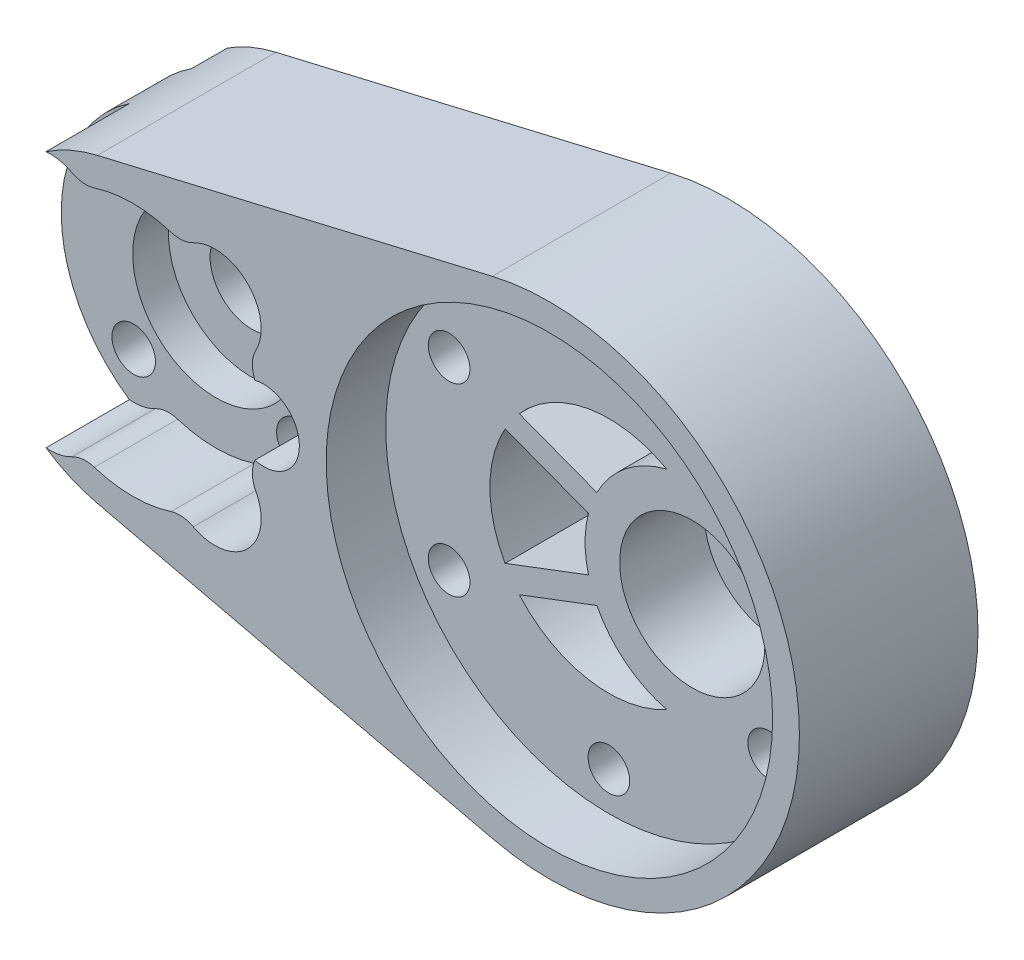
from build123d import *

# Parameters (mm, degrees)
BOSS_EXTRUDE1_DEPTH          = 15
SKETCH6_R                    = 3.5
SKETCH6_R_2                  = 1.8288
HUB_MOUNT_HOLE_PATTERN_DEPTH = 62.660360038
SKETCH7_R                    = 1.75
SKETCH7_R_2                  = 3.25
MOTOR_HOLE_PATTERN_DEPTH     = 62.660360038
SKETCH8_R                    = 18.75
MOTOR_CUTOUT_DEPTH           = 5
HUB_START                    = -7
HUB_MOUNT_CUTOUT_DEPTH       = 7
SKETCH10_R                   = 5
BOSS_EXTRUDE2_DEPTH          = 5.5
LINKAGE_PIN_HOLE_DEPTH       = 62.660360038
LINKAGE_PIN_HOLE_DEPTH_BACK  = 62.660360038
SKETCH12_R                   = 1.55
CHAMFER1_SIZE                = 2.75
SKETCH13_R                   = 6.1
CUT_EXTRUDE7_DEPTH           = 7.1
SKETCH14_R                   = 7
CUT_EXTRUDE8_DEPTH           = 3
SKETCH15_R                   = 3.5
CUT_EXTRUDE9_DEPTH           = 5
CUT_EXTRUDE10_DEPTH          = 62.312722986
CUT_EXTRUDE10_DEPTH_BACK     = 3
SKETCH16_R                   = 3
CUT_EXTRUDE12_DEPTH          = 7
BOSS_EXTRUDE3_REACH          = 63.784
CUT_EXTRUDE13_DEPTH          = 62.660360038
CUT_EXTRUDE13_DEPTH_BACK     = 3
SKETCH19_R                   = 4
FILLET1_R                    = 5


with BuildPart() as part:
    # Sketch2 → Boss-Extrude1 (new body)
    with BuildSketch(Plane.XY):
        with BuildLine():
            Line((-2.971428571, 12.655852885), (30.2, 20.444070045))
            ThreePointArc((30.2, 20.444070045), (56, 0), (30.2, -20.444070045))
            Line((30.2, -20.444070045), (-2.971428571, -12.655852885))
            ThreePointArc((-2.971428571, -12.655852885), (-13, 0), (-2.971428571, 12.655852885))
        make_face()
    extrude(amount=BOSS_EXTRUDE1_DEPTH)

    # Sketch6 → hub mount hole pattern (cut, through all)
    with BuildSketch(Plane.XY.offset(15)):
        Circle(SKETCH6_R)
        with Locations((-6.914797213, 6.914797213)):
            Circle(SKETCH6_R_2)
        with Locations((6.914797213, 6.914797213)):
            Circle(SKETCH6_R_2)
        with Locations((6.914797213, -6.914797213)):
            Circle(SKETCH6_R_2)
        with Locations((-6.914797213, -6.914797213)):
            Circle(SKETCH6_R_2)
    extrude(amount=-HUB_MOUNT_HOLE_PATTERN_DEPTH, mode=Mode.SUBTRACT)

    # Sketch7 → motor hole pattern (cut, through all)
    with BuildSketch(Plane.XY.offset(15)):
        with Locations((21.576606241, 7.75)):
            Circle(SKETCH7_R)
        with Locations((35, 15.5)):
            Circle(SKETCH7_R)
        with Locations((48.423393759, 7.75)):
            Circle(SKETCH7_R)
        with Locations((48.423393759, -7.75)):
            Circle(SKETCH7_R)
        with Locations((35, -15.5)):
            Circle(SKETCH7_R)
        with Locations((21.576606241, -7.75)):
            Circle(SKETCH7_R)
        with Locations((42, 0)):
            Circle(SKETCH7_R_2)
    extrude(amount=-MOTOR_HOLE_PATTERN_DEPTH, mode=Mode.SUBTRACT)

    # Sketch8 → motor cutout (cut)
    with BuildSketch(Plane.XY.offset(15)):
        with Locations((35, 0)):
            Circle(SKETCH8_R)
    extrude(amount=-MOTOR_CUTOUT_DEPTH, mode=Mode.SUBTRACT)

    # Sketch9 → hub mount cutout (cut)
    with BuildSketch(Plane.XY.offset(15).offset(HUB_START)):
        with BuildLine():
            ThreePointArc((-7.281143007, 10.769631215), (-13, 0), (-7.281143007, -10.769631215))
            ThreePointArc((-7.281143007, -10.769631215), (-6.15529138, -10.711783559), (-5.093815501, -10.332103173))
            ThreePointArc((-5.093815501, -10.332103173), (-4.17580433, -10.057753531), (-3.223255475, -10.161014917))
            ThreePointArc((-3.223255475, -10.161014917), (0, -10.66), (3.223255475, -10.161014917))
            ThreePointArc((3.223255475, -10.161014917), (4.17580433, -10.057753531), (5.093815501, -10.332103173))
            ThreePointArc((5.093815501, -10.332103173), (9.652858062, -9.652858062), (10.332103173, -5.093815501))
            ThreePointArc((10.332103173, -5.093815501), (10.057753531, -4.17580433), (10.161014917, -3.223255475))
            ThreePointArc((10.161014917, -3.223255475), (10.66, 0), (10.161014917, 3.223255475))
            ThreePointArc((10.161014917, 3.223255475), (10.057753531, 4.17580433), (10.332103173, 5.093815501))
            ThreePointArc((10.332103173, 5.093815501), (9.652858062, 9.652858062), (5.093815501, 10.332103173))
            ThreePointArc((5.093815501, 10.332103173), (4.17580433, 10.057753531), (3.223255475, 10.161014917))
            ThreePointArc((3.223255475, 10.161014917), (0, 10.66), (-3.223255475, 10.161014917))
            ThreePointArc((-3.223255475, 10.161014917), (-4.17580433, 10.057753531), (-5.093815501, 10.332103173))
            ThreePointArc((-5.093815501, 10.332103173), (-6.15529138, 10.711783559), (-7.281143007, 10.769631215))
        make_face()
    extrude(amount=HUB_MOUNT_CUTOUT_DEPTH, mode=Mode.SUBTRACT)

    # Sketch10 → Boss-Extrude2 (add)
    with BuildSketch(Plane(origin=(0, 0, 0), x_dir=(-1, 0, 0), z_dir=(0, 0, -1))):
        with Locations(Location((-11, 0, 0), (0, 0, 180))):
            Circle(SKETCH10_R)
    extrude(amount=BOSS_EXTRUDE2_DEPTH)

    # Sketch12 → Linkage pin hole (cut, two sides: drawn at the far end of the back side and taken through both)
    with BuildSketch(Plane.XY.offset(-LINKAGE_PIN_HOLE_DEPTH_BACK)):
        with Locations((11, 0)):
            Circle(SKETCH12_R)
    extrude(amount=LINKAGE_PIN_HOLE_DEPTH + LINKAGE_PIN_HOLE_DEPTH_BACK, mode=Mode.SUBTRACT)

    # Chamfer1
    chamfer1_edges = [part.edges().sort_by_distance(p)[0] for p in [
        (6, 0, -5.5),
    ]]
    chamfer(chamfer1_edges, length=CHAMFER1_SIZE)

    # Sketch13 → Cut-Extrude7 (cut)
    with BuildSketch(Plane.XY.offset(10)):
        with Locations((42, 0)):
            Circle(SKETCH13_R)
    extrude(amount=-CUT_EXTRUDE7_DEPTH, mode=Mode.SUBTRACT)

    # Sketch14 → Cut-Extrude8 (cut)
    with BuildSketch(Plane.XY.offset(8)):
        Circle(SKETCH14_R)
    extrude(amount=-CUT_EXTRUDE8_DEPTH, mode=Mode.SUBTRACT)

    # Sketch15 → Cut-Extrude9 (cut)
    with BuildSketch(Plane(origin=(0, 0, 0), x_dir=(-1, 0, 0), z_dir=(0, 0, -1))):
        with Locations((-21.576606241, -7.75)):
            Circle(SKETCH15_R)
        with Locations((-35, -15.5)):
            Circle(SKETCH15_R)
        with Locations((-48.423393759, -7.75)):
            Circle(SKETCH15_R)
        with Locations((-48.423393759, 7.75)):
            Circle(SKETCH15_R)
        with Locations((-35, 15.5)):
            Circle(SKETCH15_R)
        with Locations((-21.576606241, 7.75)):
            Circle(SKETCH15_R)
    extrude(amount=-CUT_EXTRUDE9_DEPTH, mode=Mode.SUBTRACT)

    # Sketch16 → Cut-Extrude10 (cut, two sides: drawn at the far end of the back side and taken through both)
    with BuildSketch(Plane.XY.offset(8).offset(-CUT_EXTRUDE10_DEPTH_BACK)):
        with Locations(Location((11, 0, 0), (0, 0, 104.35596801))):
            Circle(SKETCH16_R)
    extrude(amount=CUT_EXTRUDE10_DEPTH + CUT_EXTRUDE10_DEPTH_BACK, mode=Mode.SUBTRACT)

    # Sketch17 → Cut-Extrude12 (cut)
    with BuildSketch(Plane.XY.offset(10)):
        with BuildLine():
            ThreePointArc((39.857142857, 8.741176309), (25, 0), (39.857142857, -8.741176309))
            ThreePointArc((39.857142857, -8.741176309), (33, 0), (39.857142857, 8.741176309))
        make_face()
    extrude(amount=-CUT_EXTRUDE12_DEPTH, mode=Mode.SUBTRACT)

    # Sketch18 → Boss-Extrude3 (add, up to next)
    with BuildSketch(Plane.XY.offset(10), mode=Mode.PRIVATE) as boss_extrude3_sk1:
        with BuildLine():
            Line((27.471985333, -6.582476371), (33.992343948, -4.108216712))
            ThreePointArc((33.992343948, -4.108216712), (33.585458911, -3.193039032), (33.282779719, -2.238318693))
            Line((33.282779719, -2.238318693), (26.280269544, -4.895538864))
            ThreePointArc((26.280269544, -4.895538864), (26.83245784, -5.769857456), (27.471985333, -6.582476371))
        make_face()
    boss_extrude3_tool1 = extrude(boss_extrude3_sk1.sketch, amount=-BOSS_EXTRUDE3_REACH, mode=Mode.PRIVATE) - part.part
    # Sketch18 → Boss-Extrude3 (add, up to next)
    with BuildSketch(Plane.XY.offset(10), mode=Mode.PRIVATE) as boss_extrude3_sk2:
        with BuildLine():
            Line((27.471985333, 6.582476371), (33.992343948, 4.108216712))
            ThreePointArc((33.992343948, 4.108216712), (33.585458911, 3.193039032), (33.282779719, 2.238318693))
            Line((33.282779719, 2.238318693), (26.280269544, 4.895538864))
            ThreePointArc((26.280269544, 4.895538864), (26.83245784, 5.769857456), (27.471985333, 6.582476371))
        make_face()
    boss_extrude3_tool2 = extrude(boss_extrude3_sk2.sketch, amount=-BOSS_EXTRUDE3_REACH, mode=Mode.PRIVATE) - part.part
    add(boss_extrude3_tool1.solids().sort_by_distance((30.216616, -4.45872, 10))[0])
    add(boss_extrude3_tool2.solids().sort_by_distance((30.216616, 4.45872, 10))[0])

    # Sketch19 → Cut-Extrude13 (cut, two sides: drawn at the far end of the back side and taken through both)
    with BuildSketch(Plane(origin=(0, 0, 0), x_dir=(-1, 0, 0), z_dir=(0, 0, -1)).offset(-CUT_EXTRUDE13_DEPTH_BACK)):
        with Locations(Location((-6.914797213, -6.914797213, 0), (0, 0, 90.325769881))):
            Circle(SKETCH19_R)
        with Locations(Location((-6.914797213, 6.914797213, 0), (0, 0, 269.674230119))):
            Circle(SKETCH19_R)
        with Locations((6.914797213, 6.914797213)):
            Circle(SKETCH19_R)
        with Locations((6.914797213, -6.914797213)):
            Circle(SKETCH19_R)
    extrude(amount=CUT_EXTRUDE13_DEPTH + CUT_EXTRUDE13_DEPTH_BACK, mode=Mode.SUBTRACT)

    # Fillet1
    # the kernel refuses this fillet: 5 mm, written as the material it adds along each edge
    with BuildSketch(Plane(origin=(11, 0, 0), x_dir=(-0.9999950652018581, 0.003141587485879405, 0), z_dir=(-0.003141587485879405, -0.9999950652018581, 0))) as fillet1_piece_1_section:
        with BuildLine():
            CenterArc((9.465142775, 5), FILLET1_R, 206.74368395, 63.25631605)
            Line((9.465142775, 0), (9.465142775, -0.1))
            Line((9.465142775, -0.1), (5, -0.1))
            Line((5, -0.1), (4.9, 0))
            ThreePointArc((4.9, 0), (4.9, 1.375), (4.910697145, 2.705))
            Line((4.910697145, 2.705), (5, 2.75))
        make_face()
    fillet1_piece_1 = revolve(axis=Axis((11, 0, 0), (0, 0, -1)), revolution_arc=359.64, mode=Mode.PRIVATE)
    fillet1_piece_1 = fillet1_piece_1 - Plane(origin=(6.914797213, -6.914797213, -0.76540866), x_dir=(0.0056857263926290095, 0.9999838361270588, 0), z_dir=(0, 0, 1)) * Cylinder(4, 38, mode=Mode.PRIVATE)
    fillet1_piece_1 = fillet1_piece_1 - Plane(origin=(6.914797213, 6.914797213, -0.76540866), x_dir=(0.00568572639262881, -0.9999838361270588, 0), z_dir=(0, 0, 1)) * Cylinder(4, 38, mode=Mode.PRIVATE)
    fillet1_piece_1 = fillet1_piece_1 - Plane(origin=(0, 0, -0.76540866), x_dir=(1, 0, 0), z_dir=(0, 0, 1)) * Cylinder(3.5, 38, mode=Mode.PRIVATE)
    add(fillet1_piece_1)
    with BuildSketch(Plane(origin=(11, 0, 0), x_dir=(0.9593586032510993, -0.2821897772211103, 0), z_dir=(0.2821897772211103, 0.9593586032510993, 0))) as fillet1_piece_2_section:
        with BuildLine():
            CenterArc((9.465142775, 5), FILLET1_R, 206.74368395, 63.25631605)
            Line((9.465142775, 0), (9.465142775, -0.1))
            Line((9.465142775, -0.1), (5, -0.1))
            Line((5, -0.1), (4.9, 0))
            ThreePointArc((4.9, 0), (4.9, 1.375), (4.910697145, 2.705))
            Line((4.910697145, 2.705), (5, 2.75))
        make_face()
    fillet1_piece_2 = revolve(axis=Axis((11, 0, 0), (0, 0, -1)), revolution_arc=327.218117947, mode=Mode.PRIVATE)
    fillet1_piece_2 = fillet1_piece_2 - Plane(origin=(6.914797213, -6.914797213, -0.749324739), x_dir=(0.0056857263926290095, 0.9999838361270588, 0), z_dir=(0, 0, 1)) * Cylinder(4, 38, mode=Mode.PRIVATE)
    fillet1_piece_2 = fillet1_piece_2 - Plane(origin=(6.914797213, 6.914797213, -0.749324739), x_dir=(0.00568572639262881, -0.9999838361270588, 0), z_dir=(0, 0, 1)) * Cylinder(4, 38, mode=Mode.PRIVATE)
    fillet1_piece_2 = fillet1_piece_2 - Plane(origin=(0, 0, -0.749324739), x_dir=(1, 0, 0), z_dir=(0, 0, 1)) * Cylinder(3.5, 38, mode=Mode.PRIVATE)
    add(fillet1_piece_2)


solid = part.part
